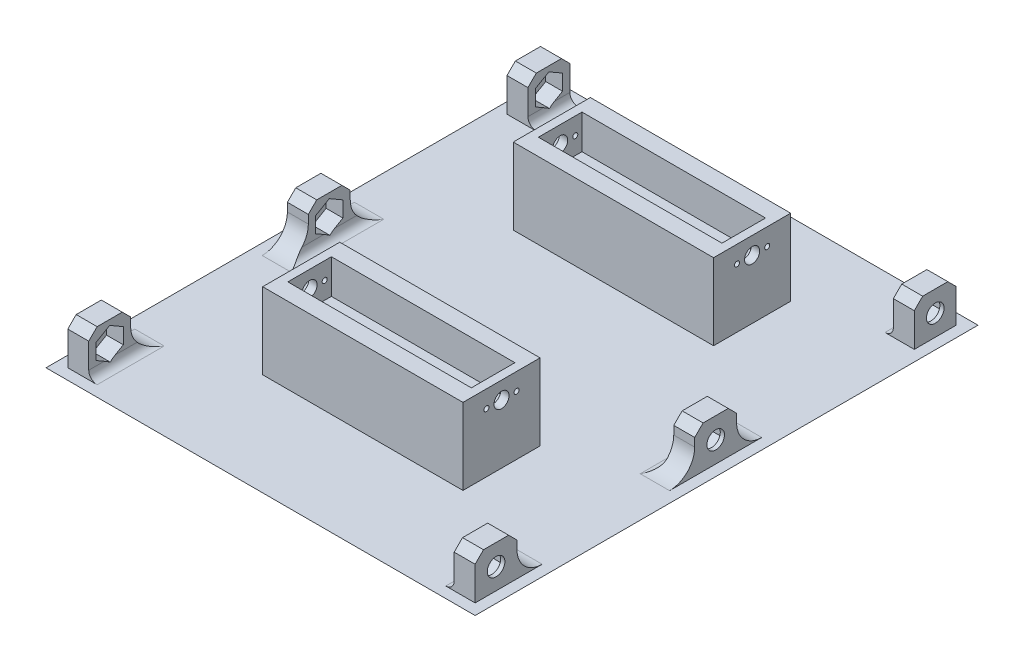
from build123d import *

# Parameters (mm, degrees)
SKETCH1_W               = 130.048
SKETCH1_H               = 152.4
BOSS_EXTRUDE1_DEPTH     = 2.54
CHAMFER1_SIZE           = 2.54
SKETCH2_W               = 60.706
SKETCH2_H               = 23.368
SKETCH2_W_2             = 55.626
SKETCH2_H_2             = 13.208
BOSS_EXTRUDE2_DEPTH     = 23.114
SKETCH2_2_W             = 55.626
SKETCH2_2_H             = 13.208
BOSS_EXTRUDE3_DEPTH     = 12.7
CUT_EXTRUDE1_DEPTH      = 104.405455814
CUT_EXTRUDE1_DEPTH_BACK = 104.405455814
SKETCH3_R               = 2.286
SKETCH3_R_2             = 0.762
SKETCH4_W               = 6.35
SKETCH4_H               = 12.7
BOSS_EXTRUDE4_DEPTH     = 12.7
CUT_EXTRUDE2_DEPTH      = 104.405455814
CUT_EXTRUDE2_DEPTH_BACK = 104.405455814
SKETCH5_R               = 2.667
CUT_EXTRUDE3_DEPTH      = 60.452
CUT_EXTRUDE3_DEPTH_BACK = 60.452
SKETCH5_3_R             = 2.667
FILLET1_R               = 7.62
FILLET2_START           = -72.898
FILLET2_DEPTH           = 1.304798
FILLET2_START_2         = -61.502798
FILLET2_2_DEPTH         = 1.304798
FILLET2_START_3         = -6.3499999
FILLET2_3_DEPTH         = 0.8385555
FILLET2_START_4         = 5.5114444
FILLET2_4_DEPTH         = 0.8385555
FILLET2_START_5         = 72.095047385
FILLET2_5_DEPTH         = 0.802952615
FILLET2_START_6         = -13.9700001
FILLET2_6_DEPTH         = 27.9400001
FILLET2_START_7         = 52.5779999
FILLET2_7_DEPTH         = 19.517047485
FILLET2_START_8         = -71.593202
FILLET2_8_DEPTH         = 10.090404
FILLET2_START_9         = -55.372
FILLET2_9_DEPTH         = 110.744
CHAMFER2_SIZE           = 2.54


with BuildPart() as part:
    # Sketch1 → Boss-Extrude1 (new body)
    with BuildSketch(Plane(origin=(0, 0, 0), x_dir=(1, 0, 0), z_dir=(0, 1, 0))):
        Rectangle(SKETCH1_W, SKETCH1_H)
    extrude(amount=BOSS_EXTRUDE1_DEPTH)

    # Chamfer1
    chamfer1_edges = [part.edges().sort_by_distance(p)[0] for p in [
        (0, 0, -76.2),
        (-65.024, 0, 0),
        (0, 0, 76.2),
        (65.024, 0, 0),
    ]]
    chamfer(chamfer1_edges, length=CHAMFER1_SIZE - 0.0001)  # a hair under: the kernel refuses the full size

    # Sketch2 → Boss-Extrude2 (add)
    # profile 1 of 2: a face of its own
    with BuildSketch(Plane(origin=(0, 2.54, 0), x_dir=(1, 0, 0), z_dir=(0, 1, 0))):
        with Locations((0, 42.418)):
            Rectangle(SKETCH2_W, SKETCH2_H)
        with Locations((0, 42.418)):
            Rectangle(SKETCH2_W_2, SKETCH2_H_2, mode=Mode.SUBTRACT)
    # profile 2 of 2: a face of its own
    with BuildSketch(Plane(origin=(0, 2.54, 0), x_dir=(1, 0, 0), z_dir=(0, 1, 0))):
        with Locations((0, -33.528)):
            Rectangle(SKETCH2_W, SKETCH2_H)
        with Locations((0, -33.528)):
            Rectangle(SKETCH2_W_2, SKETCH2_H_2, mode=Mode.SUBTRACT)
    extrude(amount=BOSS_EXTRUDE2_DEPTH)

    # Sketch2<2> → Boss-Extrude3 (add)
    with BuildSketch(Plane(origin=(0, 2.54, 0), x_dir=(1, 0, 0), z_dir=(0, 1, 0))):
        with Locations((0, -33.528)):
            Rectangle(SKETCH2_2_W, SKETCH2_2_H)
        with Locations((0, 42.418)):
            Rectangle(SKETCH2_2_W, SKETCH2_2_H)
    extrude(amount=BOSS_EXTRUDE3_DEPTH)

    # Sketch3 → Cut-Extrude1 (cut, two sides: drawn at the far end of the back side and taken through both)
    with BuildSketch(Plane(origin=(0, 0, 0), x_dir=(0, 0, -1), z_dir=(1, 0, 0)).offset(-CUT_EXTRUDE1_DEPTH_BACK)):
        with Locations((42.418, 20.447)):
            Circle(SKETCH3_R)
        with Locations((46.99, 20.447)):
            Circle(SKETCH3_R_2)
        with Locations((37.846, 20.447)):
            Circle(SKETCH3_R_2)
        with Locations((-28.956, 20.447)):
            Circle(SKETCH3_R_2)
        with Locations((-38.1, 20.447)):
            Circle(SKETCH3_R_2)
        with Locations((-33.528, 20.447)):
            Circle(SKETCH3_R)
    extrude(amount=CUT_EXTRUDE1_DEPTH + CUT_EXTRUDE1_DEPTH_BACK, mode=Mode.SUBTRACT)

    # Sketch4 → Boss-Extrude4 (add)
    with BuildSketch(Plane(origin=(0, 2.54, 0), x_dir=(1, 0, 0), z_dir=(0, 1, 0))):
        with Locations((-58.547, 66.548)):
            Rectangle(SKETCH4_W, SKETCH4_H)
        with Locations((-58.547, 0)):
            Rectangle(SKETCH4_W, SKETCH4_H)
        with Locations((-58.547, -66.548)):
            Rectangle(SKETCH4_W, SKETCH4_H)
        with Locations((58.547, -66.548)):
            Rectangle(SKETCH4_W, SKETCH4_H)
        with Locations((58.547, 0)):
            Rectangle(SKETCH4_W, SKETCH4_H)
        with Locations((58.547, 66.548)):
            Rectangle(SKETCH4_W, SKETCH4_H)
    extrude(amount=BOSS_EXTRUDE4_DEPTH)

    # Sketch5 → Cut-Extrude2 (cut, two sides: drawn at the far end of the back side and taken through both)
    with BuildSketch(Plane(origin=(0, 0, 0), x_dir=(0, 0, -1), z_dir=(1, 0, 0)).offset(-CUT_EXTRUDE2_DEPTH_BACK)):
        with Locations((-66.548, 8.89)):
            Circle(SKETCH5_R)
        with Locations((0, 8.89)):
            Circle(SKETCH5_R)
        with Locations((66.548, 8.89)):
            Circle(SKETCH5_R)
    extrude(amount=CUT_EXTRUDE2_DEPTH + CUT_EXTRUDE2_DEPTH_BACK, mode=Mode.SUBTRACT)

    # Sketch5<3> → Cut-Extrude3 (cut, two sides: drawn at the far end of the back side and taken through both)
    # profile 1 of 3: a face of its own
    with BuildSketch(Plane(origin=(0, 0, 0), x_dir=(0, 0, -1), z_dir=(1, 0, 0)).offset(-CUT_EXTRUDE3_DEPTH_BACK)):
        Polygon((0, 4.123973528), (4.1275, 6.506986764), (4.1275, 11.273013236), (0, 13.656026472), (-4.1275, 11.273013236), (-4.1275, 6.506986764), align=None)
        with Locations(Location((0, 8.89, 0), (0, 0, 180))):
            Circle(SKETCH5_3_R, mode=Mode.SUBTRACT)
    # profile 2 of 3: a face of its own
    with BuildSketch(Plane(origin=(0, 0, 0), x_dir=(0, 0, -1), z_dir=(1, 0, 0)).offset(-CUT_EXTRUDE3_DEPTH_BACK)):
        Polygon((-66.548, 4.123973528), (-62.4205, 6.506986764), (-62.4205, 11.273013236), (-66.548, 13.656026472), (-70.6755, 11.273013236), (-70.6755, 6.506986764), align=None)
        with Locations(Location((-66.548, 8.89, 0), (0, 0, 180))):
            Circle(SKETCH5_3_R, mode=Mode.SUBTRACT)
    # profile 3 of 3: a face of its own
    with BuildSketch(Plane(origin=(0, 0, 0), x_dir=(0, 0, -1), z_dir=(1, 0, 0)).offset(-CUT_EXTRUDE3_DEPTH_BACK)):
        Polygon((66.548, 4.123973528), (70.6755, 6.506986764), (70.6755, 11.273013236), (66.548, 13.656026472), (62.4205, 11.273013236), (62.4205, 6.506986764), align=None)
        with Locations(Location((66.548, 8.89, 0), (0, 0, 180))):
            Circle(SKETCH5_3_R, mode=Mode.SUBTRACT)
    extrude(amount=CUT_EXTRUDE3_DEPTH + CUT_EXTRUDE3_DEPTH_BACK, mode=Mode.SUBTRACT)

    # Fillet1
    fillet1_edges = [part.edges().sort_by_distance(p)[0] for p in [
        (-58.547, 2.54, 6.35),
        (-58.547, 2.54, -6.35),
        (-58.547, 2.54, 60.198),
        (58.547, 2.54, 60.198),
        (58.547, 2.54, -6.35),
        (58.547, 2.54, 6.35),
    ]]
    fillet(fillet1_edges, radius=FILLET1_R)

    # Fillet2: read off the stored shape, not the designer's step
    # Fillet2 outline → Fillet2 (add)
    with BuildSketch(Plane.XY.offset(FILLET2_START)):
        with BuildLine():
            Line((55.372, 2.54), (55.372, 5.08))
            ThreePointArc((55.372, 5.08), (54.628051224, 3.283948776), (52.832, 2.54))
            Line((52.832, 2.54), (55.372, 2.54))
        make_face()
        with BuildLine():
            Line((-55.372, 2.54), (-52.832, 2.54))
            ThreePointArc((-52.832, 2.54), (-54.628051224, 3.283948776), (-55.372, 5.08))
            Line((-55.372, 5.08), (-55.372, 2.54))
        make_face()
    extrude(amount=FILLET2_DEPTH)

    # Fillet2 2 outline → Fillet2 2 (add)
    with BuildSketch(Plane.XY.offset(FILLET2_START_2)):
        with BuildLine():
            Line((55.372, 2.54), (55.372, 5.08))
            ThreePointArc((55.372, 5.08), (54.628051224, 3.283948776), (52.832, 2.54))
            Line((52.832, 2.54), (55.372, 2.54))
        make_face()
        with BuildLine():
            Line((-55.372, 2.54), (-52.832, 2.54))
            ThreePointArc((-52.832, 2.54), (-54.628051224, 3.283948776), (-55.372, 5.08))
            Line((-55.372, 5.08), (-55.372, 2.54))
        make_face()
    extrude(amount=FILLET2_2_DEPTH)

    # Fillet2 3 outline → Fillet2 3 (add)
    with BuildSketch(Plane.XY.offset(FILLET2_START_3)):
        with BuildLine():
            Line((55.372, 2.54), (55.372, 5.08))
            ThreePointArc((55.372, 5.08), (54.628051224, 3.283948776), (52.832, 2.54))
            Line((52.832, 2.54), (55.372, 2.54))
        make_face()
        with BuildLine():
            Line((-55.372, 2.54), (-52.832, 2.54))
            ThreePointArc((-52.832, 2.54), (-54.628051224, 3.283948776), (-55.372, 5.08))
            Line((-55.372, 5.08), (-55.372, 2.54))
        make_face()
    extrude(amount=FILLET2_3_DEPTH)

    # Fillet2 4 outline → Fillet2 4 (add)
    with BuildSketch(Plane.XY.offset(FILLET2_START_4)):
        with BuildLine():
            Line((55.372, 2.54), (55.372, 5.08))
            ThreePointArc((55.372, 5.08), (54.628051224, 3.283948776), (52.832, 2.54))
            Line((52.832, 2.54), (55.372, 2.54))
        make_face()
        with BuildLine():
            Line((-55.372, 2.54), (-52.832, 2.54))
            ThreePointArc((-52.832, 2.54), (-54.628051224, 3.283948776), (-55.372, 5.08))
            Line((-55.372, 5.08), (-55.372, 2.54))
        make_face()
    extrude(amount=FILLET2_4_DEPTH)

    # Fillet2 5 outline → Fillet2 5 (add)
    with BuildSketch(Plane.XY.offset(FILLET2_START_5)):
        with BuildLine():
            Line((55.372, 2.54), (55.372, 5.08))
            ThreePointArc((55.372, 5.08), (54.628051224, 3.283948776), (52.832, 2.54))
            Line((52.832, 2.54), (55.372, 2.54))
        make_face()
        with BuildLine():
            Line((-55.372, 2.54), (-52.832, 2.54))
            ThreePointArc((-52.832, 2.54), (-54.628051224, 3.283948776), (-55.372, 5.08))
            Line((-55.372, 5.08), (-55.372, 2.54))
        make_face()
    extrude(amount=FILLET2_5_DEPTH)

    # Fillet2 6 outline → Fillet2 6 (add)
    with BuildSketch(Plane.XY.offset(FILLET2_START_6)):
        with BuildLine():
            Line((55.372, 2.54), (55.372, 5.08))
            ThreePointArc((55.372, 5.08), (54.628051224, 3.283948776), (52.832, 2.54))
            Line((52.832, 2.54), (55.372, 2.54))
        make_face()
        with BuildLine():
            Line((-55.372, 2.54), (-52.832, 2.54))
            ThreePointArc((-52.832, 2.54), (-54.628051224, 3.283948776), (-55.372, 5.08))
            Line((-55.372, 5.08), (-55.372, 2.54))
        make_face()
    extrude(amount=FILLET2_6_DEPTH)

    # Fillet2 7 outline → Fillet2 7 (add)
    with BuildSketch(Plane.XY.offset(FILLET2_START_7)):
        with BuildLine():
            Line((55.372, 2.54), (55.372, 5.08))
            ThreePointArc((55.372, 5.08), (54.628051224, 3.283948776), (52.832, 2.54))
            Line((52.832, 2.54), (55.372, 2.54))
        make_face()
        with BuildLine():
            Line((-55.372, 2.54), (-52.832, 2.54))
            ThreePointArc((-52.832, 2.54), (-54.628051224, 3.283948776), (-55.372, 5.08))
            Line((-55.372, 5.08), (-55.372, 2.54))
        make_face()
    extrude(amount=FILLET2_7_DEPTH)

    # Fillet2 8 outline → Fillet2 8 (add)
    with BuildSketch(Plane.XY.offset(FILLET2_START_8)):
        with BuildLine():
            Line((55.372, 2.54), (55.372, 5.08))
            ThreePointArc((55.372, 5.08), (54.628051224, 3.283948776), (52.832, 2.54))
            Line((52.832, 2.54), (55.372, 2.54))
        make_face()
        with BuildLine():
            Line((-55.372, 2.54), (-52.832, 2.54))
            ThreePointArc((-52.832, 2.54), (-54.628051224, 3.283948776), (-55.372, 5.08))
            Line((-55.372, 5.08), (-55.372, 2.54))
        make_face()
    extrude(amount=FILLET2_8_DEPTH)

    # Fillet2 9 outline → Fillet2 9 (cut)
    with BuildSketch(Plane.YZ.offset(FILLET2_START_9)):
        Polygon((4.123973528, -66.548), (5.08, -68.203886423), (5.08, -64.892113577), align=None)
        with BuildLine():
            Line((5.08, 13.97), (2.54, 13.97))
            ThreePointArc((2.54, 13.97), (3.20392352, 10.859148027), (5.08, 8.290387337))
            Line((5.08, 8.290387337), (5.08, 13.97))
        make_face()
        Polygon((4.123973528, 0), (5.08, -1.655886423), (5.08, 1.655886423), align=None)
        with BuildLine():
            ThreePointArc((5.08, -8.290387337), (3.20392352, -10.859148027), (2.54, -13.97))
            Line((2.54, -13.97), (5.08, -13.9700001))
            Line((5.08, -13.9700001), (5.08, -8.290387337))
        make_face()
        with BuildLine():
            ThreePointArc((5.08, 58.257612663), (3.20392352, 55.688851973), (2.54, 52.578))
            Line((2.54, 52.578), (5.08, 52.5779999))
            Line((5.08, 52.5779999), (5.08, 58.257612663))
        make_face()
        Polygon((4.123973528, 66.548), (5.08, 64.892113577), (5.08, 68.203886423), align=None)
    extrude(amount=FILLET2_9_DEPTH, mode=Mode.SUBTRACT)

    # Chamfer2
    chamfer2_edges = [part.edges().sort_by_distance(p)[0] for p in [
        (-58.547, 15.24, -60.198),
        (-58.547, 15.24, -72.898),
        (-58.547, 15.24, 6.35),
        (-58.547, 15.24, -6.35),
        (-58.547, 15.24, 72.898),
        (-58.547, 15.24, 60.198),
        (58.547, 15.24, 60.198),
        (58.547, 15.24, 72.898),
        (58.547, 15.24, -6.35),
        (58.547, 15.24, 6.35),
        (58.547, 15.24, -72.898),
        (58.547, 15.24, -60.198),
    ]]
    chamfer(chamfer2_edges, length=CHAMFER2_SIZE)


solid = part.part
